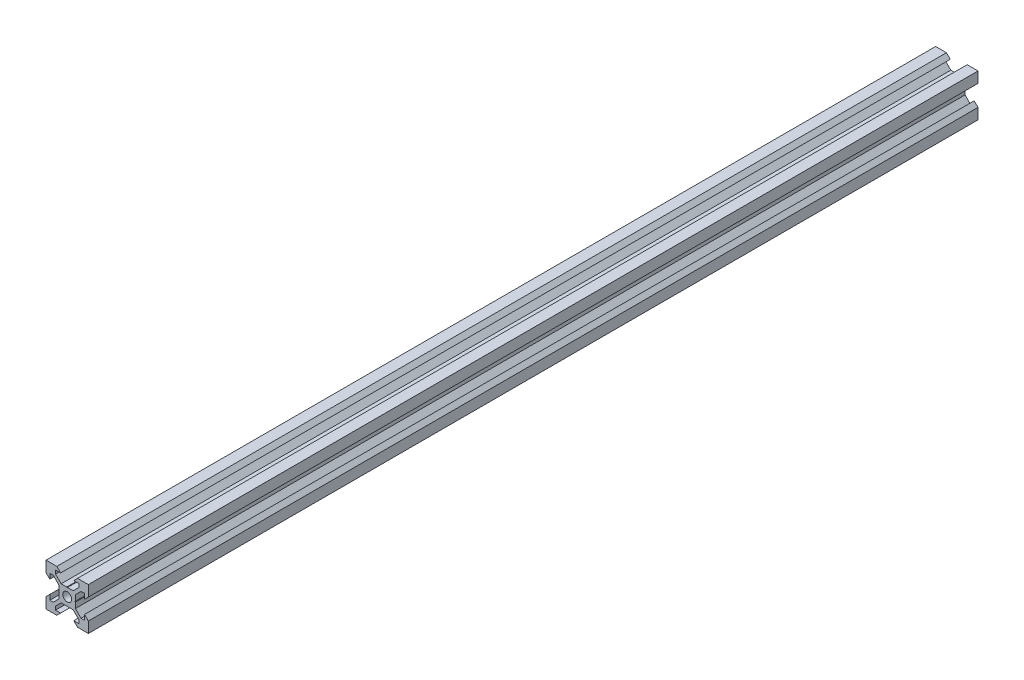
from build123d import *

# Parameters (mm, degrees)
SKETCH1_R           = 2.1
BOSS_EXTRUDE1_DEPTH = 420
CUT_EXTRUDE1_DEPTH  = 420


# Read off the part's stored shape, not the designer's step: Cut-Extrude1
with BuildPart() as part:
    # Sketch1 → Boss-Extrude1 (new body)
    with BuildSketch(Plane.XY):
        Polygon((-10, -4.9), (-10, -10), (-4.9, -10), (-3.1, -8.2), (-5.499339828, -8.2), (-5.499339828, -6.56), (-2.84, -3.900660172), (2.84, -3.900660172), (5.499339828, -6.56), (5.499339828, -8.2), (3.1, -8.2), (4.9, -10), (10, -10), (10, -4.9), (8.2, -3.1), (8.2, -5.499339828), (6.56, -5.499339828), (3.900660172, -2.84), (3.900660172, 2.84), (6.56, 5.499339828), (8.2, 5.499339828), (8.2, 3.1), (10, 4.9), (10, 10), (4.9, 10), (3.1, 8.2), (5.499339828, 8.2), (5.499339828, 6.56), (2.84, 3.900660172), (-2.84, 3.900660172), (-5.499339828, 6.56), (-5.499339828, 8.2), (-3.1, 8.2), (-4.9, 10), (-10, 10), (-10, 4.9), (-8.2, 3.1), (-8.2, 5.499339828), (-6.56, 5.499339828), (-3.900660172, 2.84), (-3.900660172, -2.84), (-6.56, -5.499339828), (-8.2, -5.499339828), (-8.2, -3.1), align=None)
        Circle(SKETCH1_R, mode=Mode.SUBTRACT)
    extrude(amount=BOSS_EXTRUDE1_DEPTH)

    # Cut-Extrude1 outline → Cut-Extrude1 (cut)
    with BuildSketch(Plane.XY):
        with BuildLine():
            Line((-3.900660172, 0.2), (-3.900660172, -0.2))
            ThreePointArc((-3.900660172, -0.2), (-3.700660172, 0), (-3.900660172, 0.2))
        make_face()
        with BuildLine():
            Line((0.2, 3.900660172), (-0.2, 3.900660172))
            ThreePointArc((-0.2, 3.900660172), (0, 3.700660172), (0.2, 3.900660172))
        make_face()
        with BuildLine():
            Line((3.900660172, -0.2), (3.900660172, 0.2))
            ThreePointArc((3.900660172, 0.2), (3.700660172, 0), (3.900660172, -0.2))
        make_face()
        with BuildLine():
            Line((-0.2, -3.900660172), (0.2, -3.900660172))
            ThreePointArc((0.2, -3.900660172), (0, -3.700660172), (-0.2, -3.900660172))
        make_face()
    extrude(amount=CUT_EXTRUDE1_DEPTH, mode=Mode.SUBTRACT)


solid = part.part
